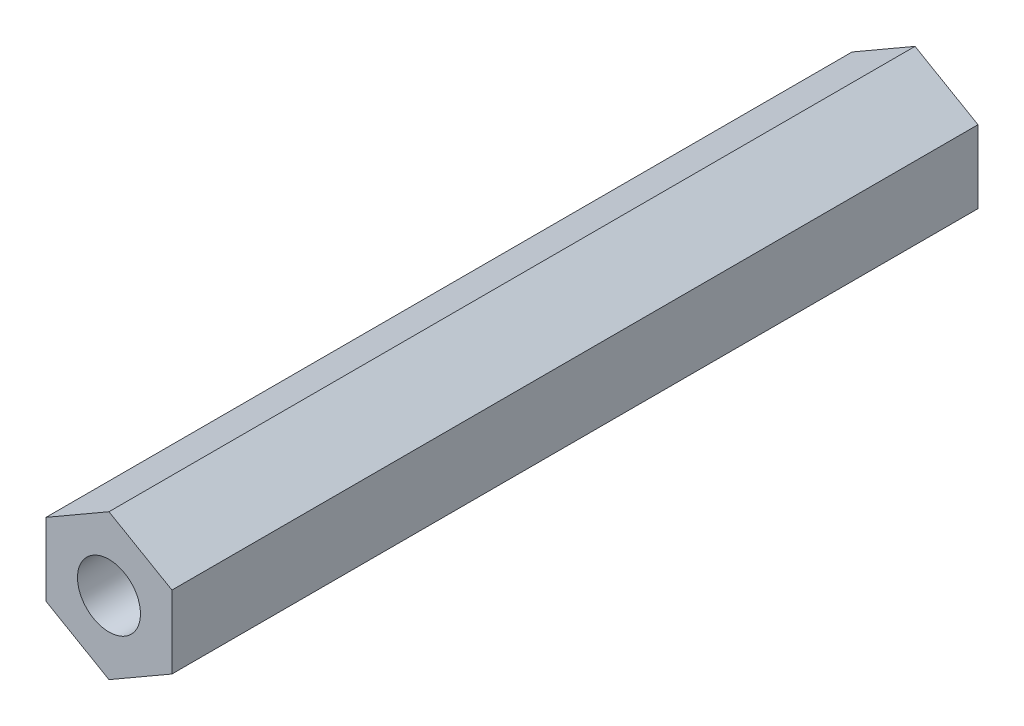
from build123d import *

# Parameters (mm, degrees)
DODANIE_WYCI_GNI_CIE1_DEPTH = 16


with BuildPart() as part:
    # Szkic1 → Dodanie-wyciągnięcie1 (new, symmetric)
    with BuildSketch(Plane.XY):
        Polygon((0, 2.886751346), (-2.5, 1.443375673), (-2.5, -1.443375673), (0, -2.886751346), (2.5, -1.443375673), (2.5, 1.443375673), align=None)
    extrude(amount=DODANIE_WYCI_GNI_CIE1_DEPTH, both=True)

    # Szkic2 → Otwór gwintowany M31 (revolve, cut)
    with BuildSketch(Plane(origin=(0, 0, 16), x_dir=(0, -1, 0), z_dir=(1, 0, 0))):
        Polygon((0, 0), (0, 9.251075774), (1.25, 8.5), (1.25, 0), align=None)
    otw_r_gwintowany_m31 = revolve(axis=Axis((0, 0, 22.35), (0, 0, -1)), mode=Mode.SUBTRACT)

    # Lustro1: Otwór gwintowany M31 across plane
    add(otw_r_gwintowany_m31.mirror(Plane.XY), mode=Mode.SUBTRACT)


solid = part.part
